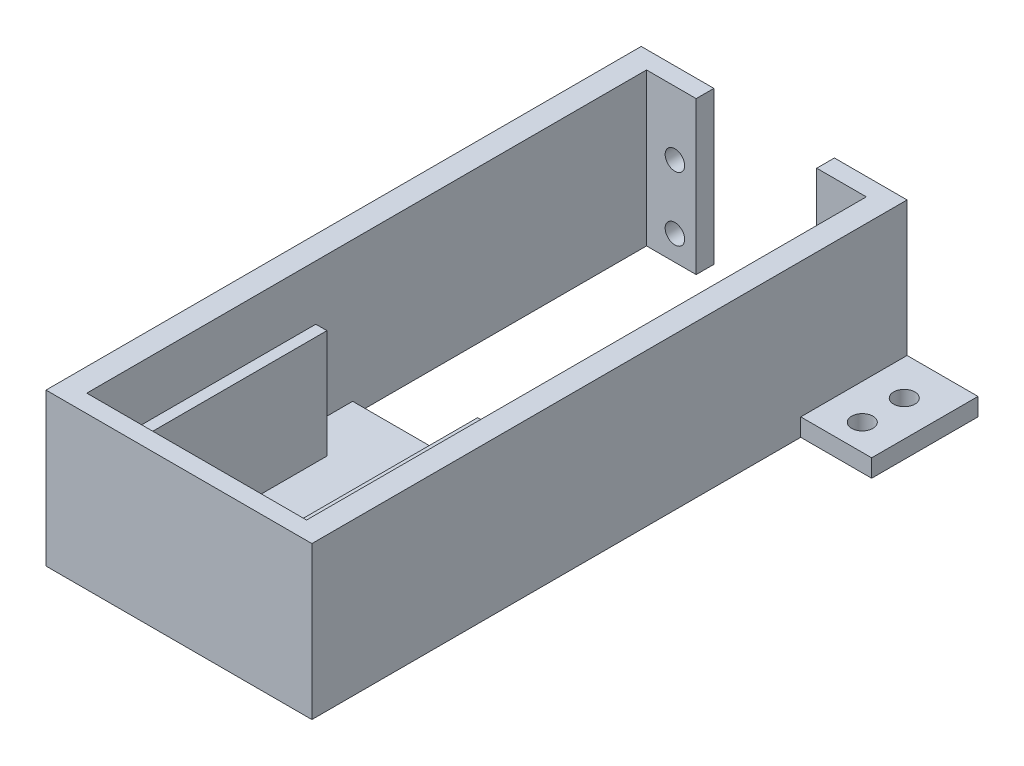
from build123d import *

# Parameters (mm, degrees)
SKETCH1_W             = 20.5
SKETCH1_H             = 43
SKETCH1_R             = 2.75
BOSS_EXTRUDE1_DEPTH   = 5
BOSS_EXTRUDE1_2_DEPTH = 5
SKETCH16_W            = 6.5
SKETCH16_H            = 43
BOSS_EXTRUDE2_DEPTH   = 162.9
SKETCH18_W            = 80
SKETCH18_H            = 3.5
BOSS_EXTRUDE3_DEPTH   = 64.9
SKETCH19_W            = 5
SKETCH19_H            = 39.5
BOSS_EXTRUDE4_DEPTH   = 64.9
SKETCH20_W            = 30
SKETCH20_H            = 5
BOSS_EXTRUDE5_DEPTH   = 20
SKETCH21_W            = 30
SKETCH21_H            = 5
BOSS_EXTRUDE6_DEPTH   = 20
SKETCH22_R            = 3
CUT_EXTRUDE1_DEPTH    = 20
SKETCH24_W            = 3.140120034
SKETCH24_H            = 30.638672015
SKETCH24_W_2          = 3.14
BOSS_EXTRUDE8_DEPTH   = 58


with BuildPart() as part:
    # Sketch1 → Boss-Extrude1 (new body)
    with BuildSketch(Plane.XY):
        with Locations((10.25, 21.5)):
            Rectangle(SKETCH1_W, SKETCH1_H)
        with Locations((14.5, 7)):
            Circle(SKETCH1_R, mode=Mode.SUBTRACT)
        with Locations((14.5, 25)):
            Circle(SKETCH1_R, mode=Mode.SUBTRACT)
    extrude(amount=BOSS_EXTRUDE1_DEPTH)



with BuildPart() as body_2:
    # Sketch1 → Boss-Extrude1 2 (new body)
    with BuildSketch(Plane.XY):
        with Locations((64.75, 21.5)):
            Rectangle(SKETCH1_W, SKETCH1_H)
        with Locations((60.5, 7)):
            Circle(SKETCH1_R, mode=Mode.SUBTRACT)
        with Locations((60.5, 25)):
            Circle(SKETCH1_R, mode=Mode.SUBTRACT)
    extrude(amount=BOSS_EXTRUDE1_2_DEPTH)


with BuildPart() as part_1:
    add(part.part)

    add(body_2.part)  # Boss-Extrude2 merges body 2
    # Sketch16 → Boss-Extrude2 (add)
    with BuildSketch(Plane.XY.offset(5)):
        with Locations((71.75, 21.5)):
            Rectangle(SKETCH16_W, SKETCH16_H)
        with Locations((3.25, 21.5)):
            Rectangle(SKETCH16_W, SKETCH16_H)
    extrude(amount=BOSS_EXTRUDE2_DEPTH)

    # Sketch18 → Boss-Extrude3 (add)
    with BuildSketch(Plane.ZY.offset(-68.5)):
        with Locations((127.9, 1.75)):
            Rectangle(SKETCH18_W, SKETCH18_H)
    extrude(amount=BOSS_EXTRUDE3_DEPTH)

    # Sketch19 → Boss-Extrude4 (add)
    with BuildSketch(Plane.ZY.offset(-68.5)):
        with Locations((165.4, 23.25)):
            Rectangle(SKETCH19_W, SKETCH19_H)
    extrude(amount=BOSS_EXTRUDE4_DEPTH)

    # Sketch20 → Boss-Extrude5 (add)
    with BuildSketch(Plane.ZY):
        with Locations((15, 2.5)):
            Rectangle(SKETCH20_W, SKETCH20_H)
    extrude(amount=BOSS_EXTRUDE5_DEPTH)

    # Sketch21 → Boss-Extrude6 (add)
    with BuildSketch(Plane(origin=(75, 0, 0), x_dir=(0, 0, -1), z_dir=(1, 0, 0))):
        with Locations((-15, 2.5)):
            Rectangle(SKETCH21_W, SKETCH21_H)
    extrude(amount=BOSS_EXTRUDE6_DEPTH)

    # Sketch22 → Cut-Extrude1 (cut)
    with BuildSketch(Plane(origin=(0, 5, 0), x_dir=(1, 0, 0), z_dir=(0, 1, 0))):
        with Locations((-10, -10.799084074)):
            Circle(SKETCH22_R)
        with Locations((-10, -22.633830435)):
            Circle(SKETCH22_R)
        with Locations((85, -10.799084074)):
            Circle(SKETCH22_R)
        with Locations((85, -22.633830435)):
            Circle(SKETCH22_R)
    extrude(amount=-CUT_EXTRUDE1_DEPTH, mode=Mode.SUBTRACT)

    # Sketch24 → Boss-Extrude8 (add)
    with BuildSketch(Plane(origin=(0, 0, 162.9), x_dir=(-1, 0, 0), z_dir=(0, 0, -1))):
        with Locations((-60.320060017, 18.819336008)):
            Rectangle(SKETCH24_W, SKETCH24_H)
        with Locations((-14.68, 18.819336008)):
            Rectangle(SKETCH24_W_2, SKETCH24_H)
    extrude(amount=BOSS_EXTRUDE8_DEPTH)


solid = part_1.part
